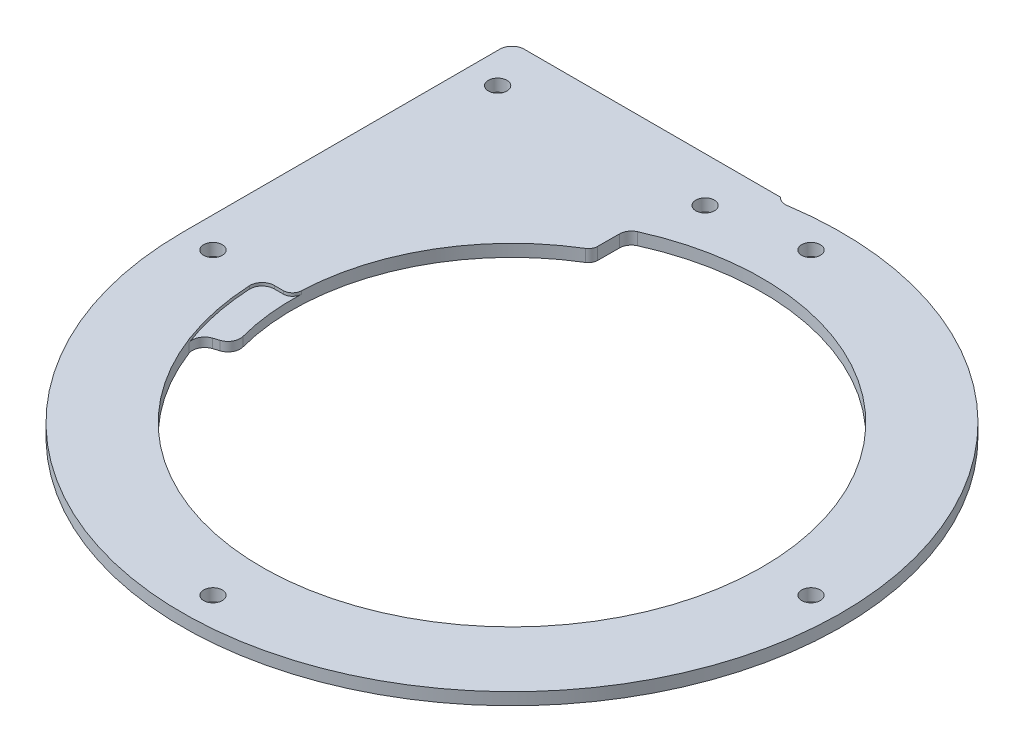
from build123d import *

# Parameters (mm, degrees)
SKETCH_1_R      = 41
SKETCH_1_R_2    = 1.525
EXTRUDE_1_DEPTH = 2
EXTRUDE_3_DEPTH = 2
FILLET_1_R      = 2
FILLET_2_R      = 2
EXTRUDE_5_DEPTH = 1.5
FILLET_3_R      = 2


with BuildPart() as part:
    # 草图1 → 凸台-拉伸1 (new body)
    with BuildSketch(Plane(origin=(0, 0, 0), x_dir=(1, 0, 0), z_dir=(0, 1, 0))):
        with BuildLine():
            Line((-54, 0), (-54, 54))
            Line((-54, 54), (-10, 54))
            Line((-10, 54), (-10, 53.065996646))
            ThreePointArc((-10, 53.065996646), (41.569219382, -34.467375879), (-54, 0))
        make_face()
        with Locations(Location((0, 0, 0), (0, 0, 270))):
            Circle(SKETCH_1_R, mode=Mode.SUBTRACT)
        with Locations(Location((-15, 46.647615159, 0), (0, 0, 270))):
            Circle(SKETCH_1_R_2, mode=Mode.SUBTRACT)
        with Locations(Location((0, 49, 0), (0, 0, 270))):
            Circle(SKETCH_1_R_2, mode=Mode.SUBTRACT)
        with Locations(Location((49, 0, 0), (0, 0, 270))):
            Circle(SKETCH_1_R_2, mode=Mode.SUBTRACT)
        with Locations(Location((0, -49, 0), (0, 0, 270))):
            Circle(SKETCH_1_R_2, mode=Mode.SUBTRACT)
        with Locations(Location((-49, 0, 0), (0, 0, 270))):
            Circle(SKETCH_1_R_2, mode=Mode.SUBTRACT)
        with Locations(Location((-49, 46.647615159, 0), (0, 0, 270))):
            Circle(SKETCH_1_R_2, mode=Mode.SUBTRACT)
    extrude(amount=EXTRUDE_1_DEPTH)

    # 草图2 → 凸台-拉伸3 (add)
    with BuildSketch(Plane(origin=(0, 0, 0), x_dir=(1, 0, 0), z_dir=(0, 1, 0))):
        with BuildLine():
            Line((-41, 0), (-37.46998799, 0))
            ThreePointArc((-37.46998799, 0), (-36.430757506, 0.418334617), (-35.971188471, 1.44))
            ThreePointArc((-35.971188471, 1.44), (-31.023847214, 18.262554696), (-18.716133348, 30.752338976))
            ThreePointArc((-18.716133348, 30.752338976), (-18.190087037, 31.295672989), (-17.99598895, 32.026605615))
            Line((-17.99598895, 32.026605615), (-17.973217018, 36.850555898))
            ThreePointArc((-17.973217018, 36.850555898), (-34.769971942, 21.726689834), (-41, 0))
        make_face()
    extrude(amount=EXTRUDE_3_DEPTH)

    # 圆角1
    fillet_1_edges = [part.edges().sort_by_distance(p)[0] for p in [
        (-17.973217018, 1, -36.850555898),
        (-41, 1, 0),
    ]]
    fillet(fillet_1_edges, radius=FILLET_1_R)

    # 圆角2
    # the kernel refuses this fillet: 2 mm, written as the material it adds along each edge
    with BuildSketch(Plane(origin=(-10, 0, -53.065996646), x_dir=(0, 0, -1), z_dir=(0, 1, 0))) as fillet_2_piece_1:
        with BuildLine():
            CenterArc((2.281728124, -1.477713756), FILLET_2_R, 132.365870045, 56.387625402)
            ThreePointArc((0.305023668, -1.782081122), (0.159970683, -0.889763893), (0, 0))
            Line((0, 0), (0.934003354, 0))
        make_face()
    extrude(amount=2)
    # the kernel refuses this fillet: 2 mm, written as the material it takes off along each edge
    with BuildSketch(Plane(origin=(-54, -5, -54), x_dir=(0, 0, 1), z_dir=(0, 1, 0))) as fillet_2_2_piece_1:
        with BuildLine():
            CenterArc((FILLET_2_R, FILLET_2_R), FILLET_2_R, 180, 90)
            Line((0, FILLET_2_R), (0, 0))
            Line((0, 0), (FILLET_2_R, 0))
        make_face()
    extrude(amount=12, mode=Mode.SUBTRACT)

    # 草图4 → 凸台-拉伸5 (add)
    with BuildSketch(Plane.XZ):
        with BuildLine():
            Line((-38.948684188, 0), (-37.46998799, 0))
            ThreePointArc((-37.46998799, 0), (-36.430757506, -0.418334617), (-35.971188471, -1.44))
            ThreePointArc((-35.971188471, -1.44), (-35.662320704, 4.919235918), (-34.238034587, 11.124611797))
            Line((-34.238034587, 11.124611797), (-38.993317168, 12.669696769))
            ThreePointArc((-38.993317168, 12.669696769), (-40.317388101, 7.450383664), (-40.946052608, 2.102564103))
            ThreePointArc((-40.946052608, 2.102564103), (-40.398706292, 0.622525537), (-38.948684188, 0))
        make_face()
    extrude(amount=-EXTRUDE_5_DEPTH)

    # 圆角3
    fillet_3_edges = [part.edges().sort_by_distance(p)[0] for p in [
        (-38.993317168, 0.75, 12.669696769),
        (-34.238034587, 0.75, 11.124611797),
    ]]
    fillet(fillet_3_edges, radius=FILLET_3_R)


solid = part.part
